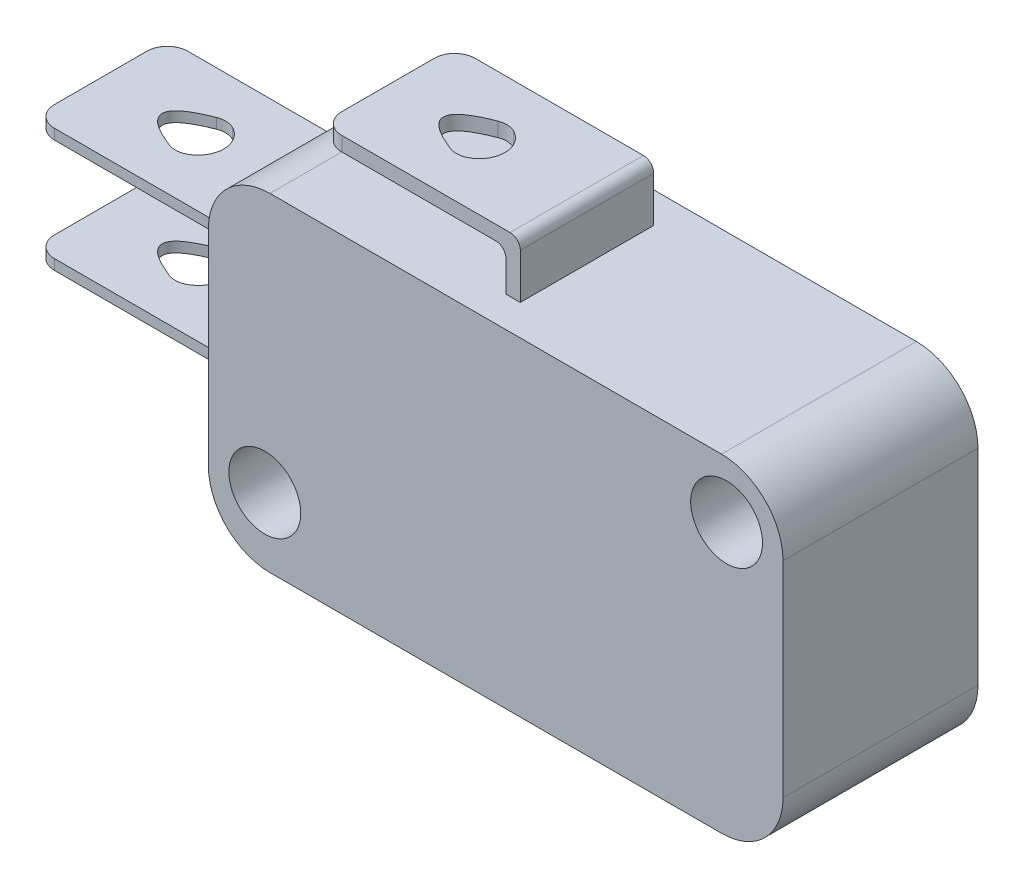
from build123d import *

# Parameters (mm, degrees)
BOSS_EXTRUDE1_DEPTH      = 3.25
BOSS_EXTRUDE1_DEPTH_BACK = 3.25
SKETCH1_W                = 10
SKETCH1_H                = 0.5
SKETCH1_W_2              = 28
SKETCH1_H_2              = 16
SKETCH1_R                = 1.75
BOSS_EXTRUDE2_DEPTH      = 1.5
BOSS_EXTRUDE2_DEPTH_BACK = 8
SKETCH2_W                = 28
SKETCH2_H                = 16
SKETCH2_R                = 1.75
CUT_EXTRUDE1_DEPTH       = 9.5
CUT_EXTRUDE2_DEPTH       = 1.5
FILLET1_R                = 1
FILLET2_R                = 1
FILLET3_R                = 3
SKETCH5_W                = 3
SKETCH5_H                = 2
BOSS_EXTRUDE3_DEPTH      = 2
FILLET4_R                = 1.5
CUT_EXTRUDE3_DEPTH       = 35.003713088
CUT_EXTRUDE3_DEPTH_BACK  = 2
SKETCH6_W                = 1
SKETCH6_H                = 4


with BuildPart() as part:
    # Sketch1 → Boss-Extrude1 (new, two sides: drawn at the far end of the back side and taken through both)
    # profile 1 of 4: a face of its own
    with BuildSketch(Plane.XY.offset(-BOSS_EXTRUDE1_DEPTH_BACK)):
        with Locations((-5, 6.25)):
            Rectangle(SKETCH1_W, SKETCH1_H)
    # profile 2 of 4: a face of its own
    with BuildSketch(Plane.XY.offset(-BOSS_EXTRUDE1_DEPTH_BACK)):
        with Locations((-5, 11.75)):
            Rectangle(SKETCH1_W, SKETCH1_H)
    # profile 3 of 4: a face of its own
    with BuildSketch(Plane.XY.offset(-BOSS_EXTRUDE1_DEPTH_BACK)):
        with Locations((14, 8)):
            Rectangle(SKETCH1_W_2, SKETCH1_H_2)
        with Locations((2.75, 3.25)):
            Circle(SKETCH1_R, mode=Mode.SUBTRACT)
        with Locations((25.25, 13.25)):
            Circle(SKETCH1_R, mode=Mode.SUBTRACT)
    # profile 4 of 4: a face of its own
    with BuildSketch(Plane.XY.offset(-BOSS_EXTRUDE1_DEPTH_BACK)):
        with BuildLine():
            Line((13, 16), (13.7, 16))
            Line((13.7, 16), (13.7, 18.2))
            ThreePointArc((13.7, 18.2), (13.553553391, 18.553553391), (13.2, 18.7))
            Line((13.2, 18.7), (4, 18.7))
            Line((4, 18.7), (4, 18))
            Line((4, 18), (12.5, 18))
            ThreePointArc((12.5, 18), (12.853553391, 17.853553391), (13, 17.5))
            Line((13, 17.5), (13, 16))
        make_face()
    extrude(amount=BOSS_EXTRUDE1_DEPTH + BOSS_EXTRUDE1_DEPTH_BACK)

    # Sketch2 → Boss-Extrude2 (add, two sides: drawn at the far end of the back side and taken through both)
    with BuildSketch(Plane(origin=(0, 0, -3.25), x_dir=(-1, 0, 0), z_dir=(0, 0, -1)).offset(-BOSS_EXTRUDE2_DEPTH_BACK)):
        with Locations((-14, 8)):
            Rectangle(SKETCH2_W, SKETCH2_H)
        with Locations(Location((-25.25, 13.25, 0), (0, 0, 180))):
            Circle(SKETCH2_R, mode=Mode.SUBTRACT)
        with Locations(Location((-2.75, 3.25, 0), (0, 0, 180))):
            Circle(SKETCH2_R, mode=Mode.SUBTRACT)
    extrude(amount=BOSS_EXTRUDE2_DEPTH + BOSS_EXTRUDE2_DEPTH_BACK)

    # Sketch3 → Cut-Extrude1 (cut)
    with BuildSketch(Plane(origin=(0, 12, 0), x_dir=(1, 0, 0), z_dir=(0, 1, 0))):
        with BuildLine():
            ThreePointArc((-5.25, -1.25), (-4, 0), (-5.25, 1.25))
            add(Edge.make_bspline(
                [(-5.25, 1.25), (-8.75, 0), (-5.25, -1.25)],
                knots=[0.849927106, 0.849927106, 0.849927106, 1.849927106, 1.849927106, 1.849927106], degree=2))
        make_face()
    extrude(amount=-CUT_EXTRUDE1_DEPTH, mode=Mode.SUBTRACT)

    # Sketch4 → Cut-Extrude2 (cut)
    with BuildSketch(Plane(origin=(0, 18.7, 0), x_dir=(1, 0, 0), z_dir=(0, 1, 0))):
        with BuildLine():
            ThreePointArc((8.45, -1.25), (9.7, 0), (8.45, 1.25))
            add(Edge.make_bspline(
                [(8.45, 1.25), (4.95, 0), (8.45, -1.25)],
                knots=[0.849927106, 0.849927106, 0.849927106, 1.849927106, 1.849927106, 1.849927106], degree=2))
        make_face()
    extrude(amount=-CUT_EXTRUDE2_DEPTH, mode=Mode.SUBTRACT)

    # Fillet1
    fillet1_edges = [part.edges().sort_by_distance(p)[0] for p in [
        (-5.25, 6.25, 1.25),
        (-5.25, 6.25, -1.25),
        (-5.25, 11.75, 1.25),
        (-5.25, 11.75, -1.25),
        (8.45, 18.35, -1.25),
        (8.45, 18.35, 1.25),
    ]]
    fillet(fillet1_edges, radius=FILLET1_R)

    # Fillet2
    fillet2_edges = [part.edges().sort_by_distance(p)[0] for p in [
        (-10, 6.25, -3.25),
        (4, 18.35, -3.25),
        (-10, 6.25, 3.25),
        (-10, 11.75, 3.25),
        (4, 18.35, 3.25),
        (-10, 11.75, -3.25),
    ]]
    fillet(fillet2_edges, radius=FILLET2_R)

    # Fillet3
    fillet3_edges = [part.edges().sort_by_distance(p)[0] for p in [
        (0, 16, 0),
        (28, 16, 0),
        (28, 0, 0),
        (0, 0, 0),
    ]]
    fillet(fillet3_edges, radius=FILLET3_R)

    # Sketch5 → Boss-Extrude3 (add)
    with BuildSketch(Plane.XZ):
        with Locations((20.5, -1)):
            Rectangle(SKETCH5_W, SKETCH5_H)
        with Locations((20.5, 1)):
            Rectangle(SKETCH5_W, SKETCH5_H)
    extrude(amount=BOSS_EXTRUDE3_DEPTH)

    # Fillet4
    fillet4_edges = [part.edges().sort_by_distance(p)[0] for p in [
        (19, -2, 0),
        (22, -2, 0),
    ]]
    fillet(fillet4_edges, radius=FILLET4_R - 0.0001)  # a hair under: the kernel refuses the full size

    # Sketch6 → Cut-Extrude3 (cut, two sides: drawn at the far end of the back side and taken through both)
    with BuildSketch(Plane.XZ.offset(-CUT_EXTRUDE3_DEPTH_BACK)):
        with Locations((9.5, 0)):
            Rectangle(SKETCH6_W, SKETCH6_H)
    extrude(amount=CUT_EXTRUDE3_DEPTH + CUT_EXTRUDE3_DEPTH_BACK, mode=Mode.SUBTRACT)


solid = part.part
